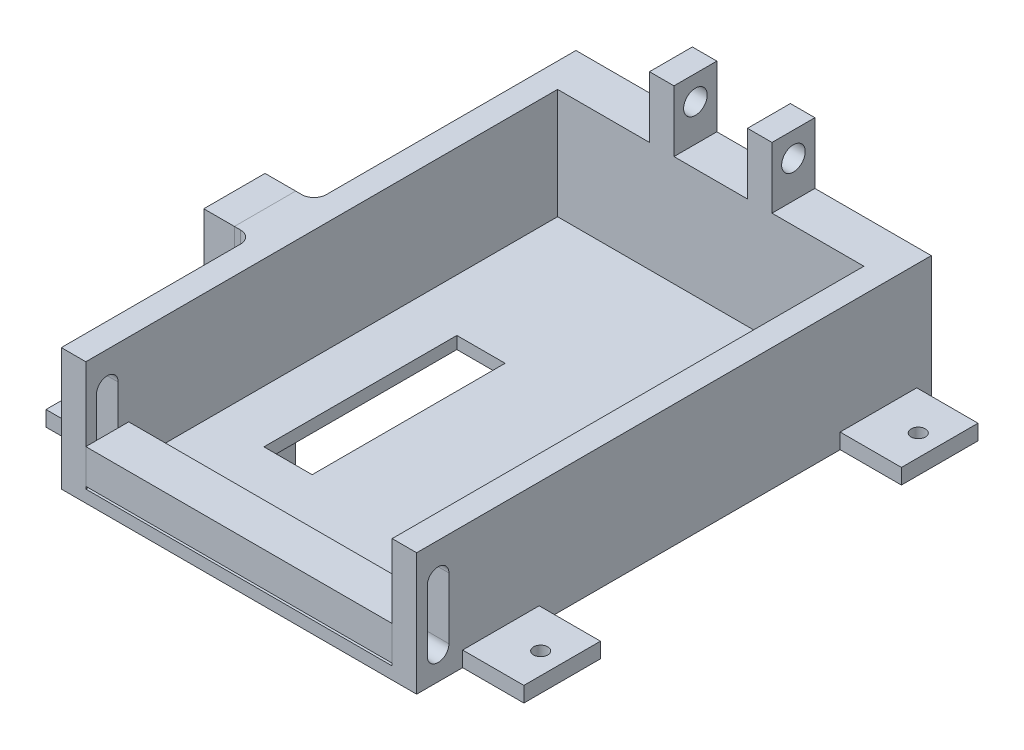
from build123d import *

# Parameters (mm, degrees)
SKETCH3_W                  = 63.5
SKETCH3_H                  = 88.9
BOSS_EXTRUDE1_DEPTH        = 2.54
BOSS_EXTRUDE2_DEPTH        = 25.4
SKETCH11_W                 = 25.4
SKETCH11_H                 = 5.08
BOSS_EXTRUDE10_DEPTH       = 12.7
SKETCH12_W                 = 15.24
SKETCH12_H                 = 5.08
CUT_EXTRUDE3_DEPTH         = 12.7
BOSS_EXTRUDE11_DEPTH       = 3.81
SKETCH13_R                 = 2.44475
CUT_EXTRUDE4_DEPTH         = 83.158301467
SKETCH5_W                  = 10
SKETCH5_H                  = 40
WHEEL_CUTOUTS_DEPTH        = 74.933200255
SKETCH7_W                  = 12.7
SKETCH7_H                  = 25.4
BOSS_EXTRUDE4_DEPTH        = 3.81
SKETCH8_W                  = 12.7
SKETCH8_H                  = 53.06
SKETCH8_R                  = 2.413
BOSS_EXTRUDE5_DEPTH        = 6.35
FILLET1_R                  = 2.54
BOSS_EXTRUDE9_START        = -2.54
SKETCH9_W                  = 63.5
SKETCH9_H                  = 8.89
BOSS_EXTRUDE9_DEPTH        = 10.16
CUT_EXTRUDE2_REACH         = 116.989
SKETCH10_W                 = 63.5
SKETCH10_H                 = 0.5
SPLIT2_START               = -31.75
SPLIT2_OUTLINE_W           = 7.12
SPLIT2_OUTLINE_H           = 8.89
SPLIT2_DEPTH               = 63.5
SPLIT2_2_OUTLINE_W         = 7.12
SPLIT2_2_OUTLINE_H         = 8.89
SPLIT2_2_DEPTH             = 63.5
SKETCH15_R                 = 2.9718
HEATSERT_HOLES_DEPTH       = 5.4
EXTRA_LENGTH_DEPTH         = 3.81
SLOT_DEPTH                 = 68.58
SKETCH18_R                 = 2.9718
MOTOR_HEATSERT_HOLES_DEPTH = 5.4
SKETCH19_R                 = 2.2479
CUT_EXTRUDE6_DEPTH         = 107.407509134
SKETCH20_W                 = 12.7
SKETCH20_H                 = 15.875
SKETCH20_R                 = 1.4732
FEET_DEPTH                 = 3.175


# Read off the part's stored shape, not the designer's step: Split2, Split3
with BuildPart() as part:
    # Sketch3 → Boss-Extrude1 (new body)
    with BuildSketch(Plane(origin=(0, 0, 0), x_dir=(1, 0, 0), z_dir=(0, 1, 0))):
        Rectangle(SKETCH3_W, SKETCH3_H)
    extrude(amount=BOSS_EXTRUDE1_DEPTH)

    # Sketch4 → Boss-Extrude2 (add)
    with BuildSketch(Plane(origin=(0, 0, 0), x_dir=(1, 0, 0), z_dir=(0, 1, 0))):
        Polygon((-31.75, -44.45), (-31.75, 44.45), (31.75, 44.45), (31.75, -44.45), (31.75, -49.53), (36.83, -49.53), (36.83, 49.53), (-36.83, 49.53), (-36.83, -49.53), (-31.75, -49.53), align=None)
    extrude(amount=BOSS_EXTRUDE2_DEPTH)

    # Sketch11 → Boss-Extrude10 (add)
    with BuildSketch(Plane(origin=(0, 25.4, 0), x_dir=(1, 0, 0), z_dir=(0, 1, 0))):
        with Locations((0, 46.99)):
            Rectangle(SKETCH11_W, SKETCH11_H)
    extrude(amount=BOSS_EXTRUDE10_DEPTH)

    # Sketch12 → Cut-Extrude3 (cut)
    with BuildSketch(Plane(origin=(0, 38.1, 0), x_dir=(1, 0, 0), z_dir=(0, 1, 0))):
        with Locations((0, 46.99)):
            Rectangle(SKETCH12_W, SKETCH12_H)
    extrude(amount=-CUT_EXTRUDE3_DEPTH, mode=Mode.SUBTRACT)

    # Sketch14 → Boss-Extrude11 (add)
    with BuildSketch(Plane(origin=(0, 0, -49.53), x_dir=(-1, 0, 0), z_dir=(0, 0, -1))):
        Polygon((12.7, 38.1), (7.62, 38.1), (7.62, 25.4), (-7.62, 25.4), (-7.62, 38.1), (-12.7, 38.1), (-12.7, 25.4), (-36.83, 25.4), (-36.83, 0), (36.83, 0), (36.83, 25.4), (12.7, 25.4), align=None)
    extrude(amount=BOSS_EXTRUDE11_DEPTH)

    # Sketch13 → Cut-Extrude4 (cut, through all)
    with BuildSketch(Plane.ZY.offset(12.7)):
        with Locations((-48.895, 33.02)):
            Circle(SKETCH13_R)
    extrude(amount=-CUT_EXTRUDE4_DEPTH, mode=Mode.SUBTRACT)

    # Sketch5 → Wheel Cutouts (cut, through all)
    with BuildSketch(Plane(origin=(0, 2.54, 0), x_dir=(1, 0, 0), z_dir=(0, 1, 0))):
        with Locations((15.875, -7.3)):
            Rectangle(SKETCH5_W, SKETCH5_H)
        with Locations((-15.875, -7.3)):
            Rectangle(SKETCH5_W, SKETCH5_H)
    extrude(amount=-WHEEL_CUTOUTS_DEPTH, mode=Mode.SUBTRACT)

    # Sketch7 → Boss-Extrude4 (add)
    with BuildSketch(Plane.ZY.offset(36.83)):
        with Locations((7.3, 12.7)):
            Rectangle(SKETCH7_W, SKETCH7_H)
    extrude(amount=BOSS_EXTRUDE4_DEPTH)

    # Sketch8 → Boss-Extrude5 (add)
    with BuildSketch(Plane.ZY.offset(40.64)):
        with Locations((7.3, -1.13)):
            Rectangle(SKETCH8_W, SKETCH8_H)
        with Locations((7.3, -21.31)):
            Circle(SKETCH8_R, mode=Mode.SUBTRACT)
        with Locations((7.3, -8.61)):
            Circle(SKETCH8_R, mode=Mode.SUBTRACT)
    extrude(amount=BOSS_EXTRUDE5_DEPTH)

    # Fillet1
    fillet1_edges = [part.edges().sort_by_distance(p)[0] for p in [
        (-36.83, 12.7, 0.95),
        (-36.83, 12.7, 13.65),
    ]]
    fillet(fillet1_edges, radius=FILLET1_R)

    # Sketch9 → Boss-Extrude9 (add)
    with BuildSketch(Plane(origin=(0, 2.54, 0), x_dir=(1, 0, 0), z_dir=(0, 1, 0)).offset(BOSS_EXTRUDE9_START)):
        with Locations((0, -48.895)):
            Rectangle(SKETCH9_W, SKETCH9_H)
    extrude(amount=BOSS_EXTRUDE9_DEPTH)

    # Cut-Extrude2: up to this face of the body (flat: up to its plane)
    cut_extrude2_end = Plane(part.part.faces().sort_by_distance((0, 5.08, 53.34))[0])
    # Sketch10 → Cut-Extrude2 (cut, up to the picked face)
    with BuildSketch(Plane(origin=(0, 0, 44.45), x_dir=(-1, 0, 0), z_dir=(0, 0, -1)), mode=Mode.PRIVATE) as cut_extrude2_sk1:
        with Locations((0, 2.79)):
            Rectangle(SKETCH10_W, SKETCH10_H)
    cut_extrude2_tool1 = split(extrude(cut_extrude2_sk1.sketch, amount=-CUT_EXTRUDE2_REACH, mode=Mode.PRIVATE), bisect_by=cut_extrude2_end, keep=Keep.BOTH, mode=Mode.PRIVATE)
    add(cut_extrude2_tool1.solids().sort_by(Axis((0, 2.79, 44.45), (0, 0, 1)))[0], mode=Mode.SUBTRACT)

    # Split2 outline → Split2 (cut)
    with BuildSketch(Plane.YZ.offset(SPLIT2_START)):
        with Locations((6.6, 48.895)):
            Rectangle(SPLIT2_OUTLINE_W, SPLIT2_OUTLINE_H)
    extrude(amount=SPLIT2_DEPTH, mode=Mode.SUBTRACT)

    # Sketch16 → Extra Length (add)
    with BuildSketch(Plane.XY.offset(49.53)):
        Polygon((-36.83, 0), (-31.75, 0), (-31.75, 2.54), (-31.75, 25.4), (-36.83, 25.4), align=None)
        Polygon((31.75, 0), (36.83, 0), (36.83, 25.4), (31.75, 25.4), (31.75, 2.54), align=None)
    extrude(amount=EXTRA_LENGTH_DEPTH)

    # Sketch17 → Slot (cut)
    with BuildSketch(Plane(origin=(36.83, 0, 0), x_dir=(0, 0, -1), z_dir=(1, 0, 0))):
        with BuildLine():
            Line((-51.1429, 5.715), (-51.1429, 18.415))
            ThreePointArc((-51.1429, 18.415), (-48.895, 20.6629), (-46.6471, 18.415))
            Line((-46.6471, 18.415), (-46.6471, 5.715))
            ThreePointArc((-46.6471, 5.715), (-48.895, 3.4671), (-51.1429, 5.715))
        make_face()
    slot = extrude(amount=-SLOT_DEPTH, mode=Mode.SUBTRACT)

    # Mirror3: Slot across plane
    add(slot.mirror(Plane(origin=(0, 0, 0), x_dir=(0, 0, 1), z_dir=(1, 0, 0))), mode=Mode.SUBTRACT)


with BuildPart() as body_2:
    # Split2 2 outline → Split2 2 (new body)
    with BuildSketch(Plane.YZ.offset(SPLIT2_START)):
        with Locations((6.6, 48.895)):
            Rectangle(SPLIT2_2_OUTLINE_W, SPLIT2_2_OUTLINE_H)
    extrude(amount=SPLIT2_2_DEPTH)

    # Sketch15 → Heatsert Holes (cut)
    with BuildSketch(Plane(origin=(31.75, 0, 0), x_dir=(0, 0, -1), z_dir=(1, 0, 0))):
        with Locations((-48.895, 6.6)):
            Circle(SKETCH15_R)
    heatsert_holes = extrude(amount=-HEATSERT_HOLES_DEPTH, mode=Mode.SUBTRACT)

    # Mirror1: Heatsert Holes across plane
    add(heatsert_holes.mirror(Plane(origin=(0, 0, 0), x_dir=(0, 0, 1), z_dir=(1, 0, 0))), mode=Mode.SUBTRACT)


with BuildPart() as body_3:
    # Split3: the piece on the far side of the plane
    add(part.part)
    split(bisect_by=Plane.YZ.offset(-40.64), keep=Keep.BOTTOM)

    # Sketch19 → Cut-Extrude6 (cut, through all)
    with BuildSketch(Plane.ZY.offset(46.99)):
        with Locations((7.3, 19.05)):
            Circle(SKETCH19_R)
        with Locations((7.3, 6.35)):
            Circle(SKETCH19_R)
    extrude(amount=-CUT_EXTRUDE6_DEPTH, mode=Mode.SUBTRACT)


with BuildPart() as part_1:
    add(part.part)

    # Split3
    split(bisect_by=Plane.YZ.offset(-40.64), keep=Keep.TOP)

    # Sketch18 → Motor Heatsert Holes (cut)
    with BuildSketch(Plane.ZY.offset(40.64)):
        with Locations((7.3, 19.05)):
            Circle(SKETCH18_R)
        with Locations((7.3, 6.35)):
            Circle(SKETCH18_R)
    extrude(amount=-MOTOR_HEATSERT_HOLES_DEPTH, mode=Mode.SUBTRACT)

    # Sketch20 → Feet (add)
    # profile 1 of 4: a face of its own
    with BuildSketch(Plane.XZ):
        with Locations((-43.18, 35.8775)):
            Rectangle(SKETCH20_W, SKETCH20_H)
        with Locations(Location((-45.085, 35.8775, 0), (0, 0, 270))):
            Circle(SKETCH20_R, mode=Mode.SUBTRACT)
    # profile 2 of 4: a face of its own
    with BuildSketch(Plane.XZ):
        with Locations((-43.18, -42.38625)):
            Rectangle(SKETCH20_W, SKETCH20_H)
        with Locations(Location((-45.085, -42.38625, 0), (0, 0, 270))):
            Circle(SKETCH20_R, mode=Mode.SUBTRACT)
    # profile 3 of 4: a face of its own
    with BuildSketch(Plane.XZ):
        with Locations((43.18, -42.38625)):
            Rectangle(SKETCH20_W, SKETCH20_H)
        with Locations(Location((45.085, -42.38625, 0), (0, 0, 90))):
            Circle(SKETCH20_R, mode=Mode.SUBTRACT)
    # profile 4 of 4: a face of its own
    with BuildSketch(Plane.XZ):
        with Locations((43.18, 35.8775)):
            Rectangle(SKETCH20_W, SKETCH20_H)
        with Locations(Location((45.085, 35.8775, 0), (0, 0, 90))):
            Circle(SKETCH20_R, mode=Mode.SUBTRACT)
    extrude(amount=-FEET_DEPTH)


solid = Compound([body_2.part, body_3.part, part_1.part])
